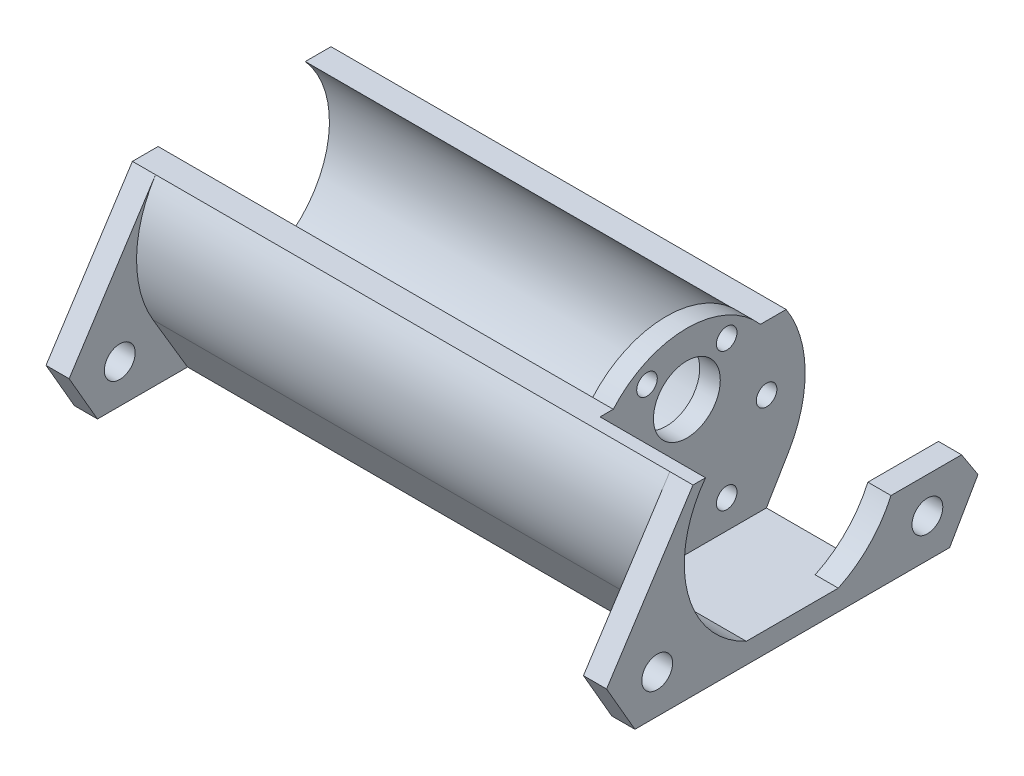
from build123d import *

# Parameters (mm, degrees)
SKETCH1_R           = 3
BOSS_EXTRUDE1_DEPTH = 54.5
CUT_EXTRUDE1_DEPTH  = 50
BOSS_EXTRUDE2_START = 34
SKETCH3_R           = 19
SKETCH3_R_2         = 6.5
SKETCH3_R_3         = 2
BOSS_EXTRUDE2_DEPTH = 4
CUT_EXTRUDE2_DEPTH  = 20.5
SKETCH5_W           = 31.652494028
SKETCH5_H           = 22.199486155
CUT_EXTRUDE3_DEPTH  = 16


# Read off the part's stored shape, not the designer's step: Cut-Extrude2
with BuildPart() as part:
    # Sketch1 → Boss-Extrude1 (new, symmetric)
    with BuildSketch(Plane(origin=(0, 0, 0), x_dir=(0, 0, -1), z_dir=(1, 0, 0))):
        with BuildLine():
            Line((26.267851073, -23), (0, -23))
            Line((0, -23), (-26.267851073, -23))
            Line((-26.267851073, -23), (-30.597978092, -23))
            Line((-30.597978092, -23), (-36.109878886, -13.453107779))
            Line((-36.109878886, -13.453107779), (-19.306734576, 12.5))
            Line((-19.306734576, 12.5), (-14.309088021, 12.5))
            ThreePointArc((-14.309088021, 12.5), (0, -19), (14.309088021, 12.5))
            Line((14.309088021, 12.5), (19.306734576, 12.5))
            Line((19.306734576, 12.5), (36.109878886, -13.453107779))
            Line((36.109878886, -13.453107779), (30.597978092, -23))
            Line((30.597978092, -23), (26.267851073, -23))
        make_face()
        with Locations((26.267851073, -15.5)):
            Circle(SKETCH1_R, mode=Mode.SUBTRACT)
        with Locations((-26.267851073, -15.5)):
            Circle(SKETCH1_R, mode=Mode.SUBTRACT)
    extrude(amount=BOSS_EXTRUDE1_DEPTH, both=True)

    # Sketch2 → Cut-Extrude1 (cut, symmetric)
    with BuildSketch(Plane(origin=(0, 0, 0), x_dir=(0, 0, -1), z_dir=(1, 0, 0))):
        with BuildLine():
            Line((19.808543432, -11.68852459), (13.089377665, -23))
            Line((13.089377665, -23), (30.597978092, -23))
            Line((30.597978092, -23), (36.109878886, -13.453107779))
            Line((36.109878886, -13.453107779), (19.306734576, 12.5))
            ThreePointArc((19.306734576, 12.5), (22.995052161, 0.477049386), (19.808543432, -11.68852459))
        make_face()
        with BuildLine():
            Line((-19.808543432, -11.68852459), (-13.089377665, -23))
            Line((-13.089377665, -23), (-30.597978092, -23))
            Line((-30.597978092, -23), (-36.109878886, -13.453107779))
            Line((-36.109878886, -13.453107779), (-19.306734576, 12.5))
            ThreePointArc((-19.306734576, 12.5), (-22.995052161, 0.477049386), (-19.808543432, -11.68852459))
        make_face()
    extrude(amount=CUT_EXTRUDE1_DEPTH, both=True, mode=Mode.SUBTRACT)

    # Sketch3 → Boss-Extrude2 (add)
    with BuildSketch(Plane(origin=(0, 0, 0), x_dir=(0, 0, -1), z_dir=(1, 0, 0)).offset(BOSS_EXTRUDE2_START)):
        Circle(SKETCH3_R)
        with Locations((0, 7)):
            Circle(SKETCH3_R_2, mode=Mode.SUBTRACT)
        with Locations((15.5, 0)):
            Circle(SKETCH3_R_3, mode=Mode.SUBTRACT)
        with Locations((7.75, -13.423393759)):
            Circle(SKETCH3_R_3, mode=Mode.SUBTRACT)
        with Locations((-7.75, -13.423393759)):
            Circle(SKETCH3_R_3, mode=Mode.SUBTRACT)
        with Locations((-15.5, 0)):
            Circle(SKETCH3_R_3, mode=Mode.SUBTRACT)
        with Locations((-7.75, 13.423393759)):
            Circle(SKETCH3_R_3, mode=Mode.SUBTRACT)
        with Locations((7.75, 13.423393759)):
            Circle(SKETCH3_R_3, mode=Mode.SUBTRACT)
    extrude(amount=-BOSS_EXTRUDE2_DEPTH)

    # Cut-Extrude2 outline → Cut-Extrude2 (cut)
    with BuildSketch(Plane(origin=(34, 0, 0), x_dir=(0, 0, -1), z_dir=(1, 0, 0))):
        with BuildLine():
            ThreePointArc((14.309088021, 12.5), (17.298843892, -7.858116823), (0, -19))
            Line((0, -19), (8.94427191, -19))
            ThreePointArc((8.94427191, -19), (15.012010115, -14.684670657), (19.192540727, -8.523284605))
            Line((19.192540727, -8.523284605), (32.918101974, -8.523284605))
            Line((32.918101974, -8.523284605), (19.306734576, 12.5))
            Line((19.306734576, 12.5), (14.309088021, 12.5))
        make_face()
        with BuildLine():
            ThreePointArc((-16.874537031, 12.5), (-20.364558031, -5.126868071), (-8.94427191, -19))
            Line((-8.94427191, -19), (0, -19))
            ThreePointArc((0, -19), (-17.298843892, -7.858116823), (-14.309088021, 12.5))
            Line((-14.309088021, 12.5), (-16.874537031, 12.5))
        make_face()
    extrude(amount=CUT_EXTRUDE2_DEPTH, mode=Mode.SUBTRACT)

    # Sketch5 → Cut-Extrude3 (cut)
    with BuildSketch(Plane(origin=(34, 0, 0), x_dir=(0, 0, -1), z_dir=(1, 0, 0))):
        with Locations((24.770518924, -7.900256922)):
            Rectangle(SKETCH5_W, SKETCH5_H)
    extrude(amount=CUT_EXTRUDE3_DEPTH, mode=Mode.SUBTRACT)


solid = part.part
